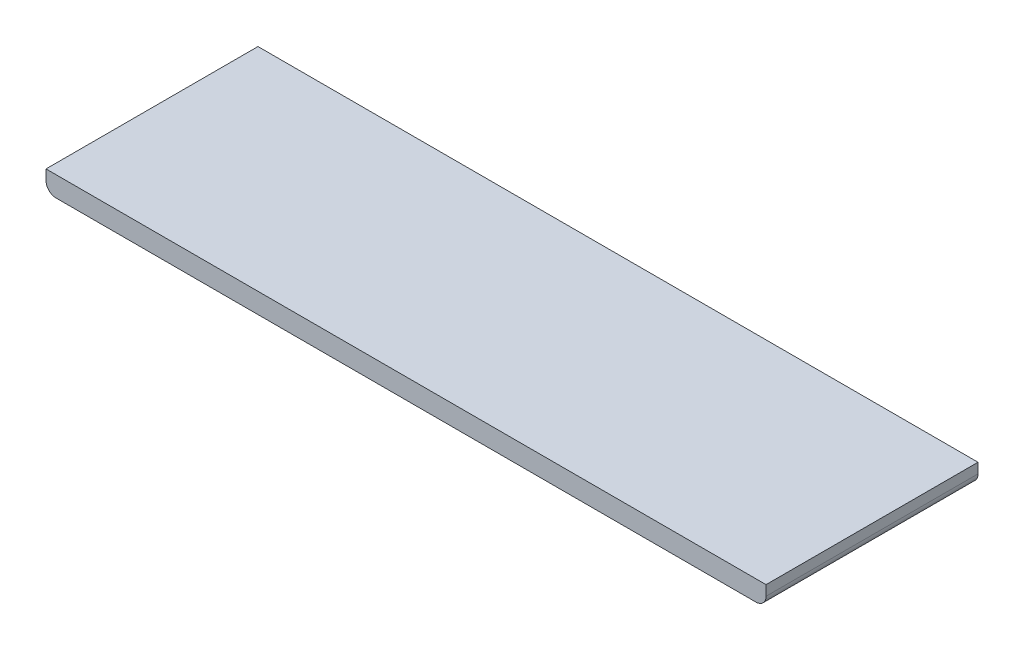
from build123d import *

# Parameters (mm, degrees)
SKETCH_1_W                         = 107
SKETCH_1_H                         = 31.5
EXTRUDE_1_DEPTH                    = 3
TOOL_D3_R1P5_FRONT_OUTER_CORNERS_R = 1.5


with BuildPart() as part:
    # Эскиз1 → Бобышка-Вытянуть1 (new body)
    with BuildSketch(Plane(origin=(0, 0, 0), x_dir=(1, 0, 0), z_dir=(0, 1, 0))):
        with Locations((53.5, -15.75)):
            Rectangle(SKETCH_1_W, SKETCH_1_H)
    extrude(amount=EXTRUDE_1_DEPTH)

    # tool_D3_R1p5_front_outer_corners
    tool_d3_r1p5_front_outer_corners_edges = [part.edges().sort_by_distance(p)[0] for p in [
        (0, 0, 15.75),
        (107, 0, 15.75),
    ]]
    fillet(tool_d3_r1p5_front_outer_corners_edges, radius=TOOL_D3_R1P5_FRONT_OUTER_CORNERS_R)


solid = part.part
